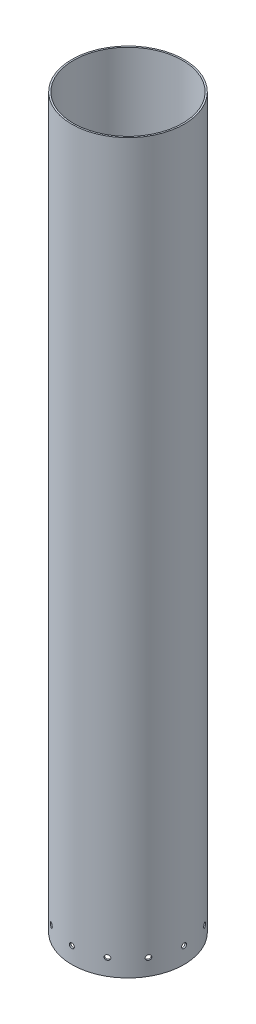
from build123d import *

# Parameters (mm, degrees)
SKETCH1_R           = 78.359
SKETCH1_R_2         = 76.2
BOSS_EXTRUDE1_DEPTH = 1016
CUT_EXTRUDE1_REACH  = 1032.998
SKETCH2_R           = 3.429
CIRPATTERN1_COUNT   = 12


with BuildPart() as part:
    # Sketch1 → Boss-Extrude1 (new body)
    with BuildSketch(Plane(origin=(0, 0, 0), x_dir=(1, 0, 0), z_dir=(0, 1, 0))):
        Circle(SKETCH1_R)
        Circle(SKETCH1_R_2, mode=Mode.SUBTRACT)
    extrude(amount=BOSS_EXTRUDE1_DEPTH)

    # Sketch2 → Cut-Extrude1 (cut, up to next)
    with BuildSketch(Plane.XY.offset(78.359), mode=Mode.PRIVATE) as cut_extrude1_sk1:
        with Locations((0, 22.86)):
            Circle(SKETCH2_R)
    cut_extrude1_tool1 = extrude(cut_extrude1_sk1.sketch, amount=-CUT_EXTRUDE1_REACH, mode=Mode.PRIVATE) & part.part
    cut_extrude1 = cut_extrude1_tool1.solids().sort_by_distance((0, 22.86, 78.359))[0]
    add(cut_extrude1, mode=Mode.SUBTRACT)

    # CirPattern1: Cut-Extrude1 ×12 about axis
    cirpattern1_axis = Axis((0, 0, 0), (0, 1, 0))
    for i in range(1, CIRPATTERN1_COUNT):
        add(cut_extrude1.rotate(cirpattern1_axis, i * 360 / CIRPATTERN1_COUNT), mode=Mode.SUBTRACT)


solid = part.part
